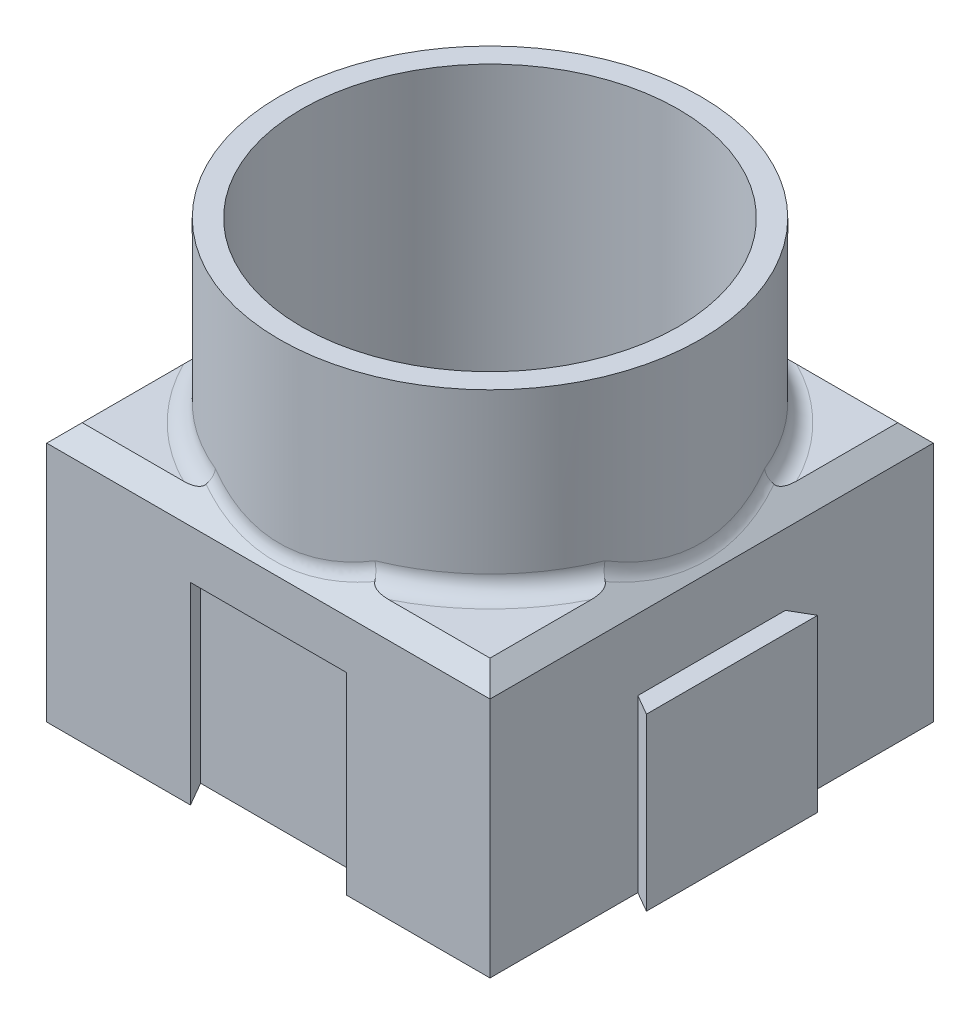
from build123d import *

# Parameters (mm, degrees)
SKETCH1_W           = 50
SKETCH1_H           = 50
BOSS_EXTRUDE1_DEPTH = 30
SKETCH2_R           = 21.25
CUT_EXTRUDE1_DEPTH  = 26
BOSS_EXTRUDE2_DEPTH = 20
BOSS_EXTRUDE3_DEPTH = 20
CUT_EXTRUDE5_DEPTH  = 20
CUT_EXTRUDE6_DEPTH  = 20
BOSS_EXTRUDE4_START = 20
SKETCH2_3_R         = 23.75
SKETCH2_3_R_2       = 21.25
BOSS_EXTRUDE4_DEPTH = 20
CHAMFER1_SIZE       = 2
SKETCH4_R           = 3.1
CUT_EXTRUDE4_DEPTH  = 4
CHAMFER3_SIZE       = 0.75
CHAMFER4_SIZE       = 2.5
FILLET1_R           = 2


with BuildPart() as part:
    # Sketch1 → Boss-Extrude1 (new body)
    with BuildSketch(Plane(origin=(0, 0, 0), x_dir=(1, 0, 0), z_dir=(0, 1, 0))):
        with Locations((25, 25)):
            Rectangle(SKETCH1_W, SKETCH1_H)
    extrude(amount=BOSS_EXTRUDE1_DEPTH)

    # Sketch2 → Cut-Extrude1 (cut)
    with BuildSketch(Plane(origin=(0, 30, 0), x_dir=(1, 0, 0), z_dir=(0, 1, 0))):
        with Locations(Location((25, 25, 0), (0, 0, 270))):
            Circle(SKETCH2_R)
    extrude(amount=-CUT_EXTRUDE1_DEPTH, mode=Mode.SUBTRACT)

    # Sketch3 → Boss-Extrude2 (add)
    with BuildSketch(Plane(origin=(0, 0, 0), x_dir=(1, 0, 0), z_dir=(0, 1, 0))):
        Polygon((50, 16.674315781), (50, 33.325684219), (52.3, 34.653589838), (52.3, 15.346410162), align=None)
    extrude(amount=BOSS_EXTRUDE2_DEPTH)

    # Sketch3<3> → Boss-Extrude3 (add)
    with BuildSketch(Plane(origin=(0, 0, 0), x_dir=(1, 0, 0), z_dir=(0, 1, 0))):
        Polygon((33.325684219, 50), (16.674315781, 50), (15.346410162, 52.3), (34.653589838, 52.3), align=None)
    extrude(amount=BOSS_EXTRUDE3_DEPTH)

    # Sketch3<6> → Cut-Extrude5 (cut)
    with BuildSketch(Plane(origin=(0, 0, 0), x_dir=(1, 0, 0), z_dir=(0, 1, 0))):
        Polygon((0, 33.787564435), (2.7, 35.346410162), (2.7, 14.653589838), (0, 16.212435565), align=None)
    extrude(amount=CUT_EXTRUDE5_DEPTH, mode=Mode.SUBTRACT)

    # Sketch3<7> → Cut-Extrude6 (cut)
    with BuildSketch(Plane(origin=(0, 0, 0), x_dir=(1, 0, 0), z_dir=(0, 1, 0))):
        Polygon((16.212435565, 0), (14.653589838, 2.7), (35.346410162, 2.7), (33.787564435, 0), align=None)
    extrude(amount=CUT_EXTRUDE6_DEPTH, mode=Mode.SUBTRACT)

    # Sketch2<3> → Boss-Extrude4 (add)
    with BuildSketch(Plane(origin=(0, 30, 0), x_dir=(1, 0, 0), z_dir=(0, 1, 0)).offset(BOSS_EXTRUDE4_START)):
        with Locations(Location((25, 25, 0), (0, 0, 90))):
            Circle(SKETCH2_3_R)
        with Locations(Location((25, 25, 0), (0, 0, 270))):
            Circle(SKETCH2_3_R_2, mode=Mode.SUBTRACT)
    extrude(amount=-BOSS_EXTRUDE4_DEPTH)

    # Chamfer1
    # the kernel refuses this chamfer: 2 mm, written as the material it takes off along each edge
    with BuildSketch(Plane(origin=(50, 30, 5.143365976), x_dir=(-0.9996219169112968, 0.027495876610585647, 0), z_dir=(0, 0, -1))) as chamfer1_piece_1_section:
        Polygon((CHAMFER1_SIZE * 0.999621916911, -CHAMFER1_SIZE * 0.0274958766106), (-CHAMFER1_SIZE * 0.0274958766106, -CHAMFER1_SIZE * 0.999621916911), (0, 0), align=None)
    chamfer1_piece_1 = extrude(amount=60.286731952, mode=Mode.PRIVATE)
    chamfer1_piece_1 = chamfer1_piece_1 - Plane(origin=(25, 29.331806076, -25), x_dir=(0, 0, -1), z_dir=(0, 1, 0)) * Cylinder(23.75, 129, mode=Mode.PRIVATE)
    add(chamfer1_piece_1, mode=Mode.SUBTRACT)
    with BuildSketch(Plane(origin=(55.143365976, 30, -50), x_dir=(0, -0.9996219169112968, -0.027495876610585647), z_dir=(-1, 0, 0))) as chamfer1_piece_2_section:
        Polygon((CHAMFER1_SIZE * 0.999621916911, CHAMFER1_SIZE * 0.0274958766106), (-CHAMFER1_SIZE * 0.0274958766106, CHAMFER1_SIZE * 0.999621916911), (0, 0), align=None)
    chamfer1_piece_2 = extrude(amount=60.286731952, mode=Mode.PRIVATE)
    chamfer1_piece_2 = chamfer1_piece_2 - Plane(origin=(25, 29.331806076, -25), x_dir=(0, 0, -1), z_dir=(0, 1, 0)) * Cylinder(23.75, 129, mode=Mode.PRIVATE)
    add(chamfer1_piece_2, mode=Mode.SUBTRACT)
    with BuildSketch(Plane(origin=(0, 30, -55.143365976), x_dir=(-0.02749587661058639, -0.9996219169112968, 0), z_dir=(0, 0, 1))) as chamfer1_piece_3_section:
        Polygon((CHAMFER1_SIZE * 0.999621916911, CHAMFER1_SIZE * 0.0274958766106), (-CHAMFER1_SIZE * 0.0274958766106, CHAMFER1_SIZE * 0.999621916911), (0, 0), align=None)
    chamfer1_piece_3 = extrude(amount=60.286731952, mode=Mode.PRIVATE)
    chamfer1_piece_3 = chamfer1_piece_3 - Plane(origin=(25, 29.331806076, -25), x_dir=(0, 0, -1), z_dir=(0, 1, 0)) * Cylinder(23.75, 129, mode=Mode.PRIVATE)
    add(chamfer1_piece_3, mode=Mode.SUBTRACT)
    with BuildSketch(Plane(origin=(-5.143365976, 30, 0), x_dir=(0, -0.9996219169112968, 0.02749587661058639), z_dir=(1, 0, 0))) as chamfer1_piece_4_section:
        Polygon((CHAMFER1_SIZE * 0.999621916911, CHAMFER1_SIZE * 0.0274958766106), (-CHAMFER1_SIZE * 0.0274958766106, CHAMFER1_SIZE * 0.999621916911), (0, 0), align=None)
    chamfer1_piece_4 = extrude(amount=60.286731952, mode=Mode.PRIVATE)
    chamfer1_piece_4 = chamfer1_piece_4 - Plane(origin=(25, 29.331806076, -25), x_dir=(0, 0, -1), z_dir=(0, 1, 0)) * Cylinder(23.75, 129, mode=Mode.PRIVATE)
    add(chamfer1_piece_4, mode=Mode.SUBTRACT)

    # Sketch4 → Cut-Extrude4 (cut)
    with BuildSketch(Plane(origin=(0, 0, 0), x_dir=(1, 0, 0), z_dir=(0, 1, 0))):
        with Locations(Location((12.5, 37.5, 0), (0, 0, 270))):
            Circle(SKETCH4_R)
        with Locations(Location((37.5, 37.5, 0), (0, 0, 270))):
            Circle(SKETCH4_R)
        with Locations(Location((37.5, 12.5, 0), (0, 0, 270))):
            Circle(SKETCH4_R)
        with Locations(Location((12.5, 12.5, 0), (0, 0, 270))):
            Circle(SKETCH4_R)
    extrude(amount=CUT_EXTRUDE4_DEPTH, mode=Mode.SUBTRACT)

    # Chamfer3
    chamfer3_edges = [part.edges().sort_by_distance(p)[0] for p in [
        (12.5, 0, -15.6),
        (37.5, 0, -15.6),
        (37.5, 0, -40.6),
        (12.5, 0, -40.6),
        (50, 0, -41.66284211),
        (51.15, 0, -16.010362971),
        (51.15, 0, -33.989637029),
        (52.3, 0, -25),
        (8.33715789, 0, -50),
        (33.989637029, 0, -51.15),
        (16.010362971, 0, -51.15),
        (25, 0, -52.3),
        (0, 0, -8.106217783),
        (1.35, 0, -15.433012702),
        (1.35, 0, -34.566987298),
        (2.7, 0, -25),
        (41.66284211, 0, -50),
        (50, 0, -8.33715789),
        (41.893782217, 0, 0),
        (8.106217783, 0, 0),
        (34.566987298, 0, -1.35),
        (15.433012702, 0, -1.35),
        (25, 0, -2.7),
        (0, 0, -41.893782217),
    ]]
    chamfer(chamfer3_edges, length=CHAMFER3_SIZE)

    # Chamfer4
    chamfer4_edges = [part.edges().sort_by_distance(p)[0] for p in [
        (0, 20, -25),
        (25, 20, 0),
    ]]
    chamfer(chamfer4_edges, length=CHAMFER4_SIZE)

    # Fillet1
    fillet1_edges = [part.edges().sort_by_distance(p)[0] for p in [
        (8.206213947, 30, -41.793786053),
        (8.206213947, 30, -8.206213947),
        (41.793786053, 30, -8.206213947),
        (41.793786053, 30, -41.793786053),
        (1.25, 29.25, -25),
        (21.992924525, 29.441137611, -48.558862389),
        (48.75, 29.25, -25),
        (25, 29.25, -1.25),
    ]]
    fillet(fillet1_edges, radius=FILLET1_R)


solid = part.part
